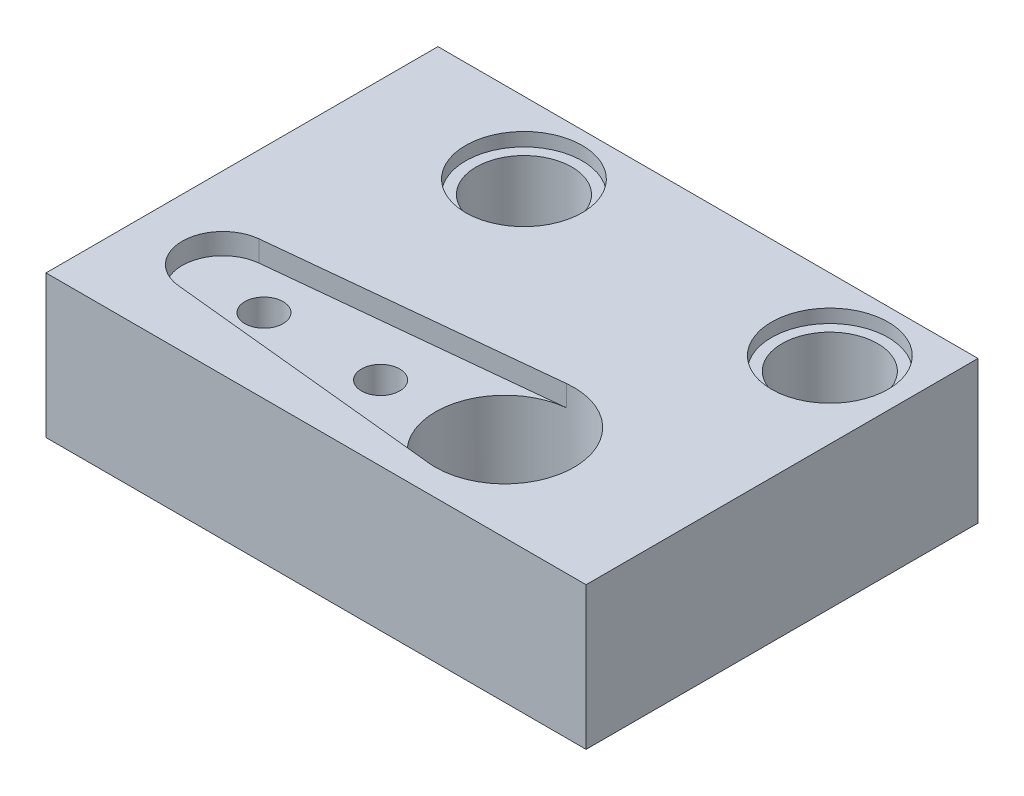
from build123d import *
from build123d.topology import SkipClean

# Parameters (mm, degrees)
SKETCH1_W           = 28.25
SKETCH1_H           = 20.5
SKETCH1_R           = 2.5
BOSS_EXTRUDE1_DEPTH = 7.46
CUT_EXTRUDE2_DEPTH  = 1.1
SKETCH5_R           = 1
SKETCH5_R_2         = 3.62054265
CUT_EXTRUDE3_DEPTH  = 26.331790304
SKETCH6_R           = 3.05
CUT_EXTRUDE4_DEPTH  = 0.7
CUT_EXTRUDE5_START  = -0.7
SKETCH7_R           = 3.05
CUT_EXTRUDE5_DEPTH  = 0.7


with BuildPart() as part:
    # Sketch1 → Boss-Extrude1 (new body)
    with BuildSketch(Plane(origin=(0, 0, 0), x_dir=(1, 0, 0), z_dir=(0, 1, 0))):
        with Locations((-4.875, 5.25)):
            Rectangle(SKETCH1_W, SKETCH1_H)
        with Locations((5.25, 11.75)):
            Circle(SKETCH1_R, mode=Mode.SUBTRACT)
        with Locations((-10.75, 11.75)):
            Circle(SKETCH1_R, mode=Mode.SUBTRACT)
    extrude(amount=BOSS_EXTRUDE1_DEPTH)

    # Sketch3 → Cut-Extrude2 (cut)
    with BuildSketch(Plane(origin=(0, 7.46, 0), x_dir=(1, 0, 0), z_dir=(0, 1, 0))):
        with BuildLine():
            Line((-14.965459534, 2.114048767), (-0.367096675, 3.601884106))
            ThreePointArc((-0.367096675, 3.601884106), (3.62054265, 0), (-0.367096675, -3.601884106))
            Line((-0.367096675, -3.601884106), (-14.965459534, -2.114048767))
            ThreePointArc((-14.965459534, -2.114048767), (-16.875, 0), (-14.965459534, 2.114048767))
        make_face()
    extrude(amount=-CUT_EXTRUDE2_DEPTH, mode=Mode.SUBTRACT)

    # Sketch5 → Cut-Extrude3 (cut, through all)
    with SkipClean():  # the faces are left unmerged after this step: merging them gives an invalid solid
        with BuildSketch(Plane(origin=(0, 6.36, 0), x_dir=(1, 0, 0), z_dir=(0, 1, 0))):
            with Locations((-12.6, 0)):
                Circle(SKETCH5_R)
            with Locations((-6.5, 0)):
                Circle(SKETCH5_R)
            Circle(SKETCH5_R_2)
        extrude(amount=-CUT_EXTRUDE3_DEPTH, mode=Mode.SUBTRACT)

    # Sketch6 → Cut-Extrude4 (cut)
    with SkipClean():  # the faces are left unmerged after this step: merging them gives an invalid solid
        with BuildSketch(Plane(origin=(0, 7.46, 0), x_dir=(1, 0, 0), z_dir=(0, 1, 0))):
            with Locations((-10.75, 11.75)):
                Circle(SKETCH6_R)
            with Locations((5.25, 11.75)):
                Circle(SKETCH6_R)
        extrude(amount=-CUT_EXTRUDE4_DEPTH, mode=Mode.SUBTRACT)

    # Sketch7 → Cut-Extrude5 (cut)
    with SkipClean():  # the faces are left unmerged after this step: merging them gives an invalid solid
        with BuildSketch(Plane.XZ.offset(CUT_EXTRUDE5_START)):
            with Locations((5.25, -11.75)):
                Circle(SKETCH7_R)
            with Locations((-10.75, -11.75)):
                Circle(SKETCH7_R)
        extrude(amount=CUT_EXTRUDE5_DEPTH, mode=Mode.SUBTRACT)


solid = part.part
